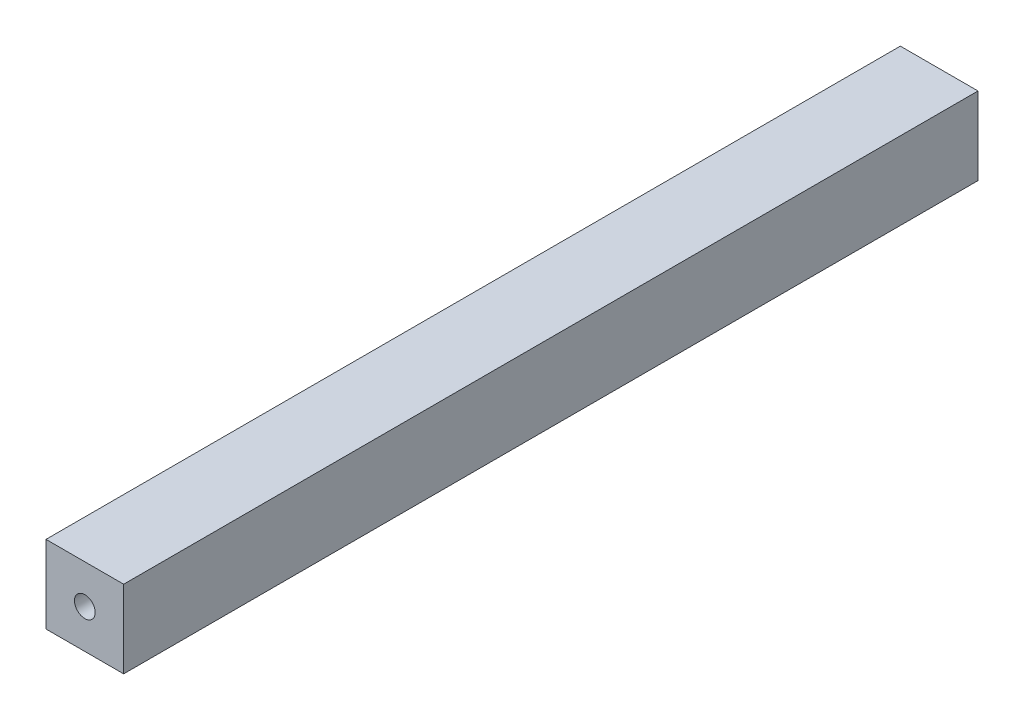
from build123d import *

# Parameters (mm, degrees)
SKETCH1_W           = 30
SKETCH1_H           = 30
BOSS_EXTRUDE1_DEPTH = 165
SKETCH2_R           = 4
CUT_EXTRUDE1_DEPTH  = 331.681115276


with BuildPart() as part:
    # Sketch1 → Boss-Extrude1 (new, symmetric)
    with BuildSketch(Plane.XY):
        Rectangle(SKETCH1_W, SKETCH1_H)
    extrude(amount=BOSS_EXTRUDE1_DEPTH, both=True)

    # Sketch2 → Cut-Extrude1 (cut, through all)
    with BuildSketch(Plane.XY.offset(165)):
        Circle(SKETCH2_R)
    extrude(amount=-CUT_EXTRUDE1_DEPTH, mode=Mode.SUBTRACT)


solid = part.part
